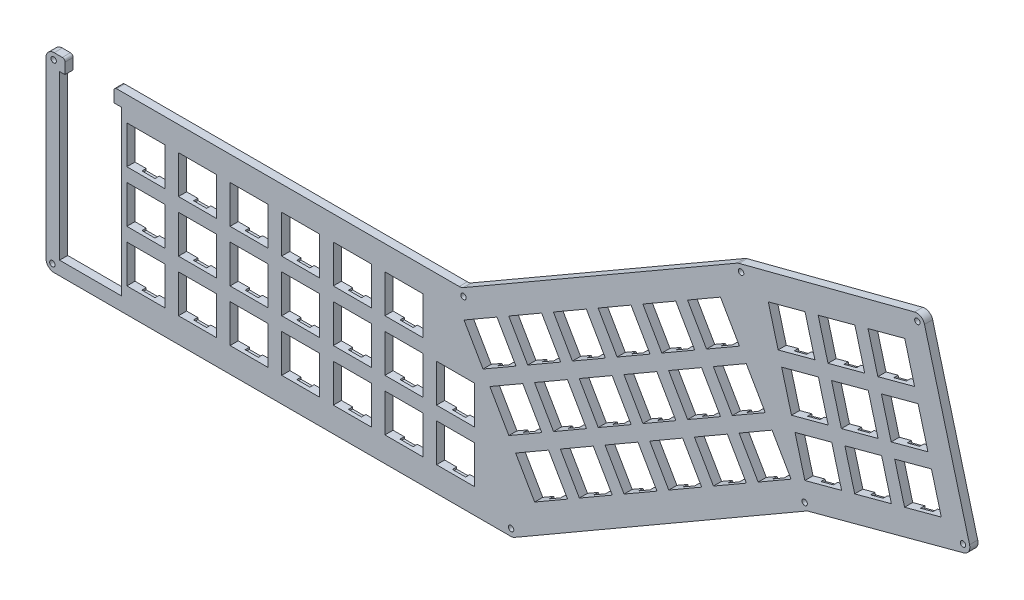
from build123d import *

# Parameters (mm, degrees)
ESQUISSE2_W                           = 14
ESQUISSE2_H                           = 14
BOSS_EXTRU_1_DEPTH                    = 3
ESQUISSE3_W                           = 4.83
ESQUISSE3_H                           = 0.7
ENL_V_MAT_EXTRU_1_DEPTH               = 1.57
R_P_TITION_LIN_AIRE1_COUNT            = 3
R_P_TITION_LIN_AIRE1_PITCH            = 19
R_P_TITION_LIN_AIRE2_COUNT            = 6
R_P_TITION_LIN_AIRE2_PITCH            = 19
R_P_TITION_LIN_AIRE2_COPY_1_SKETCH_W  = 4.83
R_P_TITION_LIN_AIRE2_COPY_1_SKETCH_H  = 0.7
R_P_TITION_LIN_AIRE2_COPY_1_DEPTH     = 1.57
R_P_TITION_LIN_AIRE2_COPY_2_SKETCH_W  = 4.83
R_P_TITION_LIN_AIRE2_COPY_2_SKETCH_H  = 0.7
R_P_TITION_LIN_AIRE2_COPY_2_DEPTH     = 1.57
R_P_TITION_LIN_AIRE2_COPY_3_SKETCH_W  = 4.83
R_P_TITION_LIN_AIRE2_COPY_3_SKETCH_H  = 0.7
R_P_TITION_LIN_AIRE2_COPY_3_DEPTH     = 1.57
R_P_TITION_LIN_AIRE2_COPY_4_SKETCH_W  = 4.83
R_P_TITION_LIN_AIRE2_COPY_4_SKETCH_H  = 0.7
R_P_TITION_LIN_AIRE2_COPY_4_DEPTH     = 1.57
R_P_TITION_LIN_AIRE2_COPY_5_SKETCH_W  = 4.83
R_P_TITION_LIN_AIRE2_COPY_5_SKETCH_H  = 0.7
R_P_TITION_LIN_AIRE2_COPY_5_DEPTH     = 1.57
R_P_TITION_LIN_AIRE2_COPY_6_SKETCH_W  = 4.83
R_P_TITION_LIN_AIRE2_COPY_6_SKETCH_H  = 0.7
R_P_TITION_LIN_AIRE2_COPY_6_DEPTH     = 1.57
R_P_TITION_LIN_AIRE2_COPY_7_SKETCH_W  = 4.83
R_P_TITION_LIN_AIRE2_COPY_7_SKETCH_H  = 0.7
R_P_TITION_LIN_AIRE2_COPY_7_DEPTH     = 1.57
R_P_TITION_LIN_AIRE2_COPY_8_SKETCH_W  = 4.83
R_P_TITION_LIN_AIRE2_COPY_8_SKETCH_H  = 0.7
R_P_TITION_LIN_AIRE2_COPY_8_DEPTH     = 1.57
R_P_TITION_LIN_AIRE2_COPY_9_SKETCH_W  = 4.83
R_P_TITION_LIN_AIRE2_COPY_9_SKETCH_H  = 0.7
R_P_TITION_LIN_AIRE2_COPY_9_DEPTH     = 1.57
R_P_TITION_LIN_AIRE2_COPY_10_SKETCH_W = 4.83
R_P_TITION_LIN_AIRE2_COPY_10_SKETCH_H = 0.7
R_P_TITION_LIN_AIRE2_COPY_10_DEPTH    = 1.57
ESQUISSE4_W                           = 4.83
ESQUISSE4_H                           = 0.7
ENL_V_MAT_EXTRU_2_DEPTH               = 1.57
R_P_TITION_LIN_AIRE3_COUNT            = 2
R_P_TITION_LIN_AIRE3_PITCH            = 19
ENL_V_MAT_EXTRU_3_DEPTH               = 1.57
R_P_TITION_LIN_AIRE4_COUNT            = 3
R_P_TITION_LIN_AIRE4_PITCH            = 19
R_P_TITION_LIN_AIRE5_COUNT            = 6
R_P_TITION_LIN_AIRE5_PITCH            = 19
R_P_TITION_LIN_AIRE5_COPY_1_DEPTH     = 1.57
R_P_TITION_LIN_AIRE5_COPY_2_DEPTH     = 1.57
R_P_TITION_LIN_AIRE5_COPY_3_DEPTH     = 1.57
R_P_TITION_LIN_AIRE5_COPY_4_DEPTH     = 1.57
R_P_TITION_LIN_AIRE5_COPY_5_DEPTH     = 1.57
R_P_TITION_LIN_AIRE5_COPY_6_DEPTH     = 1.57
R_P_TITION_LIN_AIRE5_COPY_7_DEPTH     = 1.57
R_P_TITION_LIN_AIRE5_COPY_8_DEPTH     = 1.57
R_P_TITION_LIN_AIRE5_COPY_9_DEPTH     = 1.57
R_P_TITION_LIN_AIRE5_COPY_10_DEPTH    = 1.57
ENL_V_MAT_EXTRU_4_DEPTH               = 1.57
R_P_TITION_LIN_AIRE6_COUNT            = 3
R_P_TITION_LIN_AIRE6_PITCH            = 19
R_P_TITION_LIN_AIRE7_COUNT            = 3
R_P_TITION_LIN_AIRE7_PITCH            = 19
R_P_TITION_LIN_AIRE7_COPY_1_DEPTH     = 1.57
R_P_TITION_LIN_AIRE7_COPY_2_DEPTH     = 1.57
R_P_TITION_LIN_AIRE7_COPY_3_DEPTH     = 1.57
R_P_TITION_LIN_AIRE7_COPY_4_DEPTH     = 1.57
CONG_2_R                              = 3
ESQUISSE10_R                          = 1
ENL_V_MAT_EXTRU_6_DEPTH               = 10
ESQUISSE11_W                          = 18
ESQUISSE11_H                          = 7.320487292
ENL_V_MAT_EXTRU_7_DEPTH               = 10
CONG_3_R                              = 1


with BuildPart() as part:
    # Esquisse2 → Boss.-Extru.1 (new body)
    with BuildSketch(Plane.XY):
        Polygon((75.33141454, 71.077500491), (-26.464533767, 12.30154537), (-179.373873722, 12.291034855), (-179.373873722, -50.687645053), (-179.373873722, -57.858487698), (-7.520422715, -57.858487698), (100.854480283, 4.809102496), (161.383942986, 21.020985262), (143.246352653, 88.745859712), align=None)
        with Locations((-142.608757489, -41.687645053)):
            Rectangle(ESQUISSE2_W, ESQUISSE2_H, mode=Mode.SUBTRACT)
        with Locations((-123.608757489, -41.687645053)):
            Rectangle(ESQUISSE2_W, ESQUISSE2_H, mode=Mode.SUBTRACT)
        with Locations((-104.608757489, -41.687645053)):
            Rectangle(ESQUISSE2_W, ESQUISSE2_H, mode=Mode.SUBTRACT)
        Polygon((-151.608757489, 7.292943331), (-151.608757489, 5.312354947), (-151.608757489, -50.858487698), (-151.608757489, -52.858487698), (-174.373873722, -52.858487698), (-174.373873722, 7.291378528), align=None, mode=Mode.SUBTRACT)
        with Locations((-142.608757489, -22.687645053)):
            Rectangle(ESQUISSE2_W, ESQUISSE2_H, mode=Mode.SUBTRACT)
        with Locations((-123.608757489, -22.687645053)):
            Rectangle(ESQUISSE2_W, ESQUISSE2_H, mode=Mode.SUBTRACT)
        with Locations((-104.608757489, -22.687645053)):
            Rectangle(ESQUISSE2_W, ESQUISSE2_H, mode=Mode.SUBTRACT)
        with Locations((-85.608757489, -41.687645053)):
            Rectangle(ESQUISSE2_W, ESQUISSE2_H, mode=Mode.SUBTRACT)
        with Locations((-66.608757489, -41.687645053)):
            Rectangle(ESQUISSE2_W, ESQUISSE2_H, mode=Mode.SUBTRACT)
        with Locations((-47.608757489, -41.687645053)):
            Rectangle(ESQUISSE2_W, ESQUISSE2_H, mode=Mode.SUBTRACT)
        with Locations((-28.608757489, -41.687645053)):
            Rectangle(ESQUISSE2_W, ESQUISSE2_H, mode=Mode.SUBTRACT)
        with Locations((-85.608757489, -22.687645053)):
            Rectangle(ESQUISSE2_W, ESQUISSE2_H, mode=Mode.SUBTRACT)
        with Locations((-66.608757489, -22.687645053)):
            Rectangle(ESQUISSE2_W, ESQUISSE2_H, mode=Mode.SUBTRACT)
        with Locations((-47.608757489, -22.687645053)):
            Rectangle(ESQUISSE2_W, ESQUISSE2_H, mode=Mode.SUBTRACT)
        with Locations((-28.608757489, -22.687645053)):
            Rectangle(ESQUISSE2_W, ESQUISSE2_H, mode=Mode.SUBTRACT)
        with Locations((-142.608757489, -3.687645053)):
            Rectangle(ESQUISSE2_W, ESQUISSE2_H, mode=Mode.SUBTRACT)
        with Locations((-123.608757489, -3.687645053)):
            Rectangle(ESQUISSE2_W, ESQUISSE2_H, mode=Mode.SUBTRACT)
        with Locations((-104.608757489, -3.687645053)):
            Rectangle(ESQUISSE2_W, ESQUISSE2_H, mode=Mode.SUBTRACT)
        with Locations((-85.608757489, -3.687645053)):
            Rectangle(ESQUISSE2_W, ESQUISSE2_H, mode=Mode.SUBTRACT)
        with Locations((-66.608757489, -3.687645053)):
            Rectangle(ESQUISSE2_W, ESQUISSE2_H, mode=Mode.SUBTRACT)
        with Locations((-47.608757489, -3.687645053)):
            Rectangle(ESQUISSE2_W, ESQUISSE2_H, mode=Mode.SUBTRACT)
        Polygon((-25.494741241, 2.507177858), (-13.370385588, 9.507177858), (-6.370385588, -2.617177795), (-18.494741241, -9.617177795), align=None, mode=Mode.SUBTRACT)
        Polygon((-6.494741241, -30.401787486), (5.629614412, -23.401787486), (12.629614412, -35.526143139), (0.505258759, -42.526143139), align=None, mode=Mode.SUBTRACT)
        Polygon((9.959741431, -20.901787486), (22.084097084, -13.901787486), (29.084097084, -26.026143139), (16.959741431, -33.026143139), align=None, mode=Mode.SUBTRACT)
        Polygon((-15.994741241, -13.947304814), (-3.870385588, -6.947304814), (3.129614412, -19.071660467), (-8.994741241, -26.071660467), align=None, mode=Mode.SUBTRACT)
        Polygon((0.459741431, -4.447304814), (12.584097084, 2.552695186), (19.584097084, -9.571660467), (7.459741431, -16.571660467), align=None, mode=Mode.SUBTRACT)
        Polygon((26.414224103, -11.401787486), (38.538579756, -4.401787486), (45.538579756, -16.526143139), (33.414224103, -23.526143139), align=None, mode=Mode.SUBTRACT)
        Polygon((42.868706775, -1.901787486), (54.993062428, 5.098212514), (61.993062428, -7.026143139), (49.868706775, -14.026143139), align=None, mode=Mode.SUBTRACT)
        Polygon((16.914224103, 5.052695186), (29.038579756, 12.052695186), (36.038579756, -0.071660467), (23.914224103, -7.071660467), align=None, mode=Mode.SUBTRACT)
        Polygon((-9.040258569, 12.007177858), (3.084097084, 19.007177858), (10.084097084, 6.882822205), (-2.040258569, -0.117177795), align=None, mode=Mode.SUBTRACT)
        Polygon((59.323189447, 7.598212514), (71.4475451, 14.598212514), (78.4475451, 2.473856861), (66.323189447, -4.526143139), align=None, mode=Mode.SUBTRACT)
        Polygon((33.368706775, 14.552695186), (45.493062428, 21.552695186), (52.493062428, 9.428339533), (40.368706775, 2.428339533), align=None, mode=Mode.SUBTRACT)
        Polygon((75.777672119, 17.098212514), (87.902027772, 24.098212514), (94.902027772, 11.973856861), (82.777672119, 4.973856861), align=None, mode=Mode.SUBTRACT)
        Polygon((7.414224103, 21.507177858), (19.538579756, 28.507177858), (26.538579756, 16.382822205), (14.414224103, 9.382822205), align=None, mode=Mode.SUBTRACT)
        Polygon((23.868706775, 31.007177858), (35.993062428, 38.007177858), (42.993062428, 25.882822205), (30.868706775, 18.882822205), align=None, mode=Mode.SUBTRACT)
        Polygon((49.823189447, 24.052695186), (61.9475451, 31.052695186), (68.9475451, 18.928339533), (56.823189447, 11.928339533), align=None, mode=Mode.SUBTRACT)
        Polygon((66.277672119, 33.552695186), (78.402027772, 40.552695186), (85.402027772, 28.428339533), (73.277672119, 21.428339533), align=None, mode=Mode.SUBTRACT)
        Polygon((40.323189447, 40.507177858), (52.4475451, 47.507177858), (59.4475451, 35.382822205), (47.323189447, 28.382822205), align=None, mode=Mode.SUBTRACT)
        Polygon((56.777672119, 50.007177858), (68.902027772, 57.007177858), (75.902027772, 44.882822205), (63.777672119, 37.882822205), align=None, mode=Mode.SUBTRACT)
        Polygon((99.972171674, 14.073979229), (96.348705043, 27.596940797), (109.871666611, 31.220407428), (113.495133242, 17.69744586), align=None, mode=Mode.SUBTRACT)
        Polygon((118.324762374, 18.991541086), (114.701295742, 32.514502654), (128.22425731, 36.137969285), (131.847723942, 22.615007717), align=None, mode=Mode.SUBTRACT)
        Polygon((136.677353073, 23.909102943), (133.053886442, 37.432064511), (146.57684801, 41.055531142), (150.200314641, 27.532569574), align=None, mode=Mode.SUBTRACT)
        Polygon((95.054609817, 32.426569928), (91.431143186, 45.949531496), (104.954104754, 49.572998128), (108.577571385, 36.05003656), align=None, mode=Mode.SUBTRACT)
        Polygon((113.407200517, 37.344131785), (109.783733885, 50.867093353), (123.306695453, 54.490559985), (126.930162085, 40.967598417), align=None, mode=Mode.SUBTRACT)
        Polygon((131.759791216, 42.261693642), (128.136324585, 55.78465521), (141.659286153, 59.408121842), (145.282752784, 45.885160273), align=None, mode=Mode.SUBTRACT)
        Polygon((90.13704796, 50.779160628), (86.513581329, 64.302122196), (100.036542897, 67.925588827), (103.660009528, 54.402627259), align=None, mode=Mode.SUBTRACT)
        Polygon((108.48963866, 55.696722485), (104.866172028, 69.219684053), (118.389133596, 72.843150684), (122.012600228, 59.320189116), align=None, mode=Mode.SUBTRACT)
        Polygon((126.842229359, 60.614284342), (123.218762728, 74.13724591), (136.741724296, 77.760712541), (140.365190927, 64.237750973), align=None, mode=Mode.SUBTRACT)
    extrude(amount=BOSS_EXTRU_1_DEPTH)

    # Esquisse3 → Enlèv. mat.-Extru.1 (cut)
    with BuildSketch(Plane(origin=(0, 0, 0), x_dir=(-1, 0, 0), z_dir=(0, 0, -1))):
        with Locations((143.081022506, 3.662354947)):
            Rectangle(ESQUISSE3_W, ESQUISSE3_H)
        with Locations((143.081022506, -11.037645053)):
            Rectangle(ESQUISSE3_W, ESQUISSE3_H)
    enl_v_mat_extru_1 = extrude(amount=-ENL_V_MAT_EXTRU_1_DEPTH, mode=Mode.SUBTRACT)

    # Répétition linéaire1: Enlèv. mat.-Extru.1 ×3
    with Locations(*[(0, -i * R_P_TITION_LIN_AIRE1_PITCH, 0) for i in range(1, R_P_TITION_LIN_AIRE1_COUNT)]):
        add(enl_v_mat_extru_1, mode=Mode.SUBTRACT)

    # Répétition linéaire2: Enlèv. mat.-Extru.1 ×6
    with Locations(*[(i * R_P_TITION_LIN_AIRE2_PITCH, 0, 0) for i in range(1, R_P_TITION_LIN_AIRE2_COUNT)]):
        add(enl_v_mat_extru_1, mode=Mode.SUBTRACT)

    # Répétition linéaire2 copy 1 sketch → Répétition linéaire2 copy 1 (cut)
    with BuildSketch(Plane(origin=(19, -19, 0), x_dir=(-1, 0, 0), z_dir=(0, 0, -1))):
        with Locations((143.081022506, 3.662354947)):
            Rectangle(R_P_TITION_LIN_AIRE2_COPY_1_SKETCH_W, R_P_TITION_LIN_AIRE2_COPY_1_SKETCH_H)
        with Locations((143.081022506, -11.037645053)):
            Rectangle(R_P_TITION_LIN_AIRE2_COPY_1_SKETCH_W, R_P_TITION_LIN_AIRE2_COPY_1_SKETCH_H)
    extrude(amount=-R_P_TITION_LIN_AIRE2_COPY_1_DEPTH, mode=Mode.SUBTRACT)

    # Répétition linéaire2 copy 2 sketch → Répétition linéaire2 copy 2 (cut)
    with BuildSketch(Plane(origin=(38, -19, 0), x_dir=(-1, 0, 0), z_dir=(0, 0, -1))):
        with Locations((143.081022506, 3.662354947)):
            Rectangle(R_P_TITION_LIN_AIRE2_COPY_2_SKETCH_W, R_P_TITION_LIN_AIRE2_COPY_2_SKETCH_H)
        with Locations((143.081022506, -11.037645053)):
            Rectangle(R_P_TITION_LIN_AIRE2_COPY_2_SKETCH_W, R_P_TITION_LIN_AIRE2_COPY_2_SKETCH_H)
    extrude(amount=-R_P_TITION_LIN_AIRE2_COPY_2_DEPTH, mode=Mode.SUBTRACT)

    # Répétition linéaire2 copy 3 sketch → Répétition linéaire2 copy 3 (cut)
    with BuildSketch(Plane(origin=(57, -19, 0), x_dir=(-1, 0, 0), z_dir=(0, 0, -1))):
        with Locations((143.081022506, 3.662354947)):
            Rectangle(R_P_TITION_LIN_AIRE2_COPY_3_SKETCH_W, R_P_TITION_LIN_AIRE2_COPY_3_SKETCH_H)
        with Locations((143.081022506, -11.037645053)):
            Rectangle(R_P_TITION_LIN_AIRE2_COPY_3_SKETCH_W, R_P_TITION_LIN_AIRE2_COPY_3_SKETCH_H)
    extrude(amount=-R_P_TITION_LIN_AIRE2_COPY_3_DEPTH, mode=Mode.SUBTRACT)

    # Répétition linéaire2 copy 4 sketch → Répétition linéaire2 copy 4 (cut)
    with BuildSketch(Plane(origin=(76, -19, 0), x_dir=(-1, 0, 0), z_dir=(0, 0, -1))):
        with Locations((143.081022506, 3.662354947)):
            Rectangle(R_P_TITION_LIN_AIRE2_COPY_4_SKETCH_W, R_P_TITION_LIN_AIRE2_COPY_4_SKETCH_H)
        with Locations((143.081022506, -11.037645053)):
            Rectangle(R_P_TITION_LIN_AIRE2_COPY_4_SKETCH_W, R_P_TITION_LIN_AIRE2_COPY_4_SKETCH_H)
    extrude(amount=-R_P_TITION_LIN_AIRE2_COPY_4_DEPTH, mode=Mode.SUBTRACT)

    # Répétition linéaire2 copy 5 sketch → Répétition linéaire2 copy 5 (cut)
    with BuildSketch(Plane(origin=(95, -19, 0), x_dir=(-1, 0, 0), z_dir=(0, 0, -1))):
        with Locations((143.081022506, 3.662354947)):
            Rectangle(R_P_TITION_LIN_AIRE2_COPY_5_SKETCH_W, R_P_TITION_LIN_AIRE2_COPY_5_SKETCH_H)
        with Locations((143.081022506, -11.037645053)):
            Rectangle(R_P_TITION_LIN_AIRE2_COPY_5_SKETCH_W, R_P_TITION_LIN_AIRE2_COPY_5_SKETCH_H)
    extrude(amount=-R_P_TITION_LIN_AIRE2_COPY_5_DEPTH, mode=Mode.SUBTRACT)

    # Répétition linéaire2 copy 6 sketch → Répétition linéaire2 copy 6 (cut)
    with BuildSketch(Plane(origin=(19, -38, 0), x_dir=(-1, 0, 0), z_dir=(0, 0, -1))):
        with Locations((143.081022506, 3.662354947)):
            Rectangle(R_P_TITION_LIN_AIRE2_COPY_6_SKETCH_W, R_P_TITION_LIN_AIRE2_COPY_6_SKETCH_H)
        with Locations((143.081022506, -11.037645053)):
            Rectangle(R_P_TITION_LIN_AIRE2_COPY_6_SKETCH_W, R_P_TITION_LIN_AIRE2_COPY_6_SKETCH_H)
    extrude(amount=-R_P_TITION_LIN_AIRE2_COPY_6_DEPTH, mode=Mode.SUBTRACT)

    # Répétition linéaire2 copy 7 sketch → Répétition linéaire2 copy 7 (cut)
    with BuildSketch(Plane(origin=(38, -38, 0), x_dir=(-1, 0, 0), z_dir=(0, 0, -1))):
        with Locations((143.081022506, 3.662354947)):
            Rectangle(R_P_TITION_LIN_AIRE2_COPY_7_SKETCH_W, R_P_TITION_LIN_AIRE2_COPY_7_SKETCH_H)
        with Locations((143.081022506, -11.037645053)):
            Rectangle(R_P_TITION_LIN_AIRE2_COPY_7_SKETCH_W, R_P_TITION_LIN_AIRE2_COPY_7_SKETCH_H)
    extrude(amount=-R_P_TITION_LIN_AIRE2_COPY_7_DEPTH, mode=Mode.SUBTRACT)

    # Répétition linéaire2 copy 8 sketch → Répétition linéaire2 copy 8 (cut)
    with BuildSketch(Plane(origin=(57, -38, 0), x_dir=(-1, 0, 0), z_dir=(0, 0, -1))):
        with Locations((143.081022506, 3.662354947)):
            Rectangle(R_P_TITION_LIN_AIRE2_COPY_8_SKETCH_W, R_P_TITION_LIN_AIRE2_COPY_8_SKETCH_H)
        with Locations((143.081022506, -11.037645053)):
            Rectangle(R_P_TITION_LIN_AIRE2_COPY_8_SKETCH_W, R_P_TITION_LIN_AIRE2_COPY_8_SKETCH_H)
    extrude(amount=-R_P_TITION_LIN_AIRE2_COPY_8_DEPTH, mode=Mode.SUBTRACT)

    # Répétition linéaire2 copy 9 sketch → Répétition linéaire2 copy 9 (cut)
    with BuildSketch(Plane(origin=(76, -38, 0), x_dir=(-1, 0, 0), z_dir=(0, 0, -1))):
        with Locations((143.081022506, 3.662354947)):
            Rectangle(R_P_TITION_LIN_AIRE2_COPY_9_SKETCH_W, R_P_TITION_LIN_AIRE2_COPY_9_SKETCH_H)
        with Locations((143.081022506, -11.037645053)):
            Rectangle(R_P_TITION_LIN_AIRE2_COPY_9_SKETCH_W, R_P_TITION_LIN_AIRE2_COPY_9_SKETCH_H)
    extrude(amount=-R_P_TITION_LIN_AIRE2_COPY_9_DEPTH, mode=Mode.SUBTRACT)

    # Répétition linéaire2 copy 10 sketch → Répétition linéaire2 copy 10 (cut)
    with BuildSketch(Plane(origin=(95, -38, 0), x_dir=(-1, 0, 0), z_dir=(0, 0, -1))):
        with Locations((143.081022506, 3.662354947)):
            Rectangle(R_P_TITION_LIN_AIRE2_COPY_10_SKETCH_W, R_P_TITION_LIN_AIRE2_COPY_10_SKETCH_H)
        with Locations((143.081022506, -11.037645053)):
            Rectangle(R_P_TITION_LIN_AIRE2_COPY_10_SKETCH_W, R_P_TITION_LIN_AIRE2_COPY_10_SKETCH_H)
    extrude(amount=-R_P_TITION_LIN_AIRE2_COPY_10_DEPTH, mode=Mode.SUBTRACT)

    # Esquisse4 → Enlèv. mat.-Extru.2 (cut)
    with BuildSketch(Plane(origin=(0, 0, 0), x_dir=(-1, 0, 0), z_dir=(0, 0, -1))):
        with Locations((28.76106948, -15.337645053)):
            Rectangle(ESQUISSE4_W, ESQUISSE4_H)
        with Locations((28.76106948, -30.037645053)):
            Rectangle(ESQUISSE4_W, ESQUISSE4_H)
    enl_v_mat_extru_2 = extrude(amount=-ENL_V_MAT_EXTRU_2_DEPTH, mode=Mode.SUBTRACT)

    # Répétition linéaire3: Enlèv. mat.-Extru.2 ×2
    with Locations(*[(0, -i * R_P_TITION_LIN_AIRE3_PITCH, 0) for i in range(1, R_P_TITION_LIN_AIRE3_COUNT)]):
        add(enl_v_mat_extru_2, mode=Mode.SUBTRACT)

    # Esquisse6 → Enlèv. mat.-Extru.3 (cut)
    with BuildSketch(Plane(origin=(0, 0, 0), x_dir=(-1, 0, 0), z_dir=(0, 0, -1))):
        Polygon((17.330819297, 7.22062039), (21.513721997, 4.80562039), (21.863602937, 5.411631954), (17.680700237, 7.826631954), align=None)
        Polygon((10.330819297, -4.903735263), (14.513721997, -7.318735263), (14.163841058, -7.924746828), (9.980938357, -5.509746828), align=None)
    enl_v_mat_extru_3 = extrude(amount=-ENL_V_MAT_EXTRU_3_DEPTH, mode=Mode.SUBTRACT)

    # Répétition linéaire4: Enlèv. mat.-Extru.3 ×3
    with Locations(*[Vector(0.4999999999994475, -0.8660254037847577, 0) * (i * R_P_TITION_LIN_AIRE4_PITCH) for i in range(1, R_P_TITION_LIN_AIRE4_COUNT)]):
        add(enl_v_mat_extru_3, mode=Mode.SUBTRACT)

    # Répétition linéaire5: Enlèv. mat.-Extru.3 ×6
    with Locations(*[Vector(0.8660254037829719, 0.5000000000025406, 0) * (i * R_P_TITION_LIN_AIRE5_PITCH) for i in range(1, R_P_TITION_LIN_AIRE5_COUNT)]):
        add(enl_v_mat_extru_3, mode=Mode.SUBTRACT)

    # Répétition linéaire5 copy 1 sketch → Répétition linéaire5 copy 1 (cut)
    with BuildSketch(Plane(origin=(25.954482672, -6.954482672, 0), x_dir=(-1, 0, 0), z_dir=(0, 0, -1))):
        Polygon((17.330819297, 7.22062039), (21.513721997, 4.80562039), (21.863602937, 5.411631954), (17.680700237, 7.826631954), align=None)
        Polygon((10.330819297, -4.903735263), (14.513721997, -7.318735263), (14.163841058, -7.924746828), (9.980938357, -5.509746828), align=None)
    extrude(amount=-R_P_TITION_LIN_AIRE5_COPY_1_DEPTH, mode=Mode.SUBTRACT)

    # Répétition linéaire5 copy 2 sketch → Répétition linéaire5 copy 2 (cut)
    with BuildSketch(Plane(origin=(42.408965344, 2.545517328, 0), x_dir=(-1, 0, 0), z_dir=(0, 0, -1))):
        Polygon((17.330819297, 7.22062039), (21.513721997, 4.80562039), (21.863602937, 5.411631954), (17.680700237, 7.826631954), align=None)
        Polygon((10.330819297, -4.903735263), (14.513721997, -7.318735263), (14.163841058, -7.924746828), (9.980938357, -5.509746828), align=None)
    extrude(amount=-R_P_TITION_LIN_AIRE5_COPY_2_DEPTH, mode=Mode.SUBTRACT)

    # Répétition linéaire5 copy 3 sketch → Répétition linéaire5 copy 3 (cut)
    with BuildSketch(Plane(origin=(58.863448016, 12.045517328, 0), x_dir=(-1, 0, 0), z_dir=(0, 0, -1))):
        Polygon((17.330819297, 7.22062039), (21.513721997, 4.80562039), (21.863602937, 5.411631954), (17.680700237, 7.826631954), align=None)
        Polygon((10.330819297, -4.903735263), (14.513721997, -7.318735263), (14.163841058, -7.924746828), (9.980938357, -5.509746828), align=None)
    extrude(amount=-R_P_TITION_LIN_AIRE5_COPY_3_DEPTH, mode=Mode.SUBTRACT)

    # Répétition linéaire5 copy 4 sketch → Répétition linéaire5 copy 4 (cut)
    with BuildSketch(Plane(origin=(75.317930687, 21.545517328, 0), x_dir=(-1, 0, 0), z_dir=(0, 0, -1))):
        Polygon((17.330819297, 7.22062039), (21.513721997, 4.80562039), (21.863602937, 5.411631954), (17.680700237, 7.826631954), align=None)
        Polygon((10.330819297, -4.903735263), (14.513721997, -7.318735263), (14.163841058, -7.924746828), (9.980938357, -5.509746828), align=None)
    extrude(amount=-R_P_TITION_LIN_AIRE5_COPY_4_DEPTH, mode=Mode.SUBTRACT)

    # Répétition linéaire5 copy 5 sketch → Répétition linéaire5 copy 5 (cut)
    with BuildSketch(Plane(origin=(91.772413359, 31.045517328, 0), x_dir=(-1, 0, 0), z_dir=(0, 0, -1))):
        Polygon((17.330819297, 7.22062039), (21.513721997, 4.80562039), (21.863602937, 5.411631954), (17.680700237, 7.826631954), align=None)
        Polygon((10.330819297, -4.903735263), (14.513721997, -7.318735263), (14.163841058, -7.924746828), (9.980938357, -5.509746828), align=None)
    extrude(amount=-R_P_TITION_LIN_AIRE5_COPY_5_DEPTH, mode=Mode.SUBTRACT)

    # Répétition linéaire5 copy 6 sketch → Répétition linéaire5 copy 6 (cut)
    with BuildSketch(Plane(origin=(35.454482672, -23.408965344, 0), x_dir=(-1, 0, 0), z_dir=(0, 0, -1))):
        Polygon((17.330819297, 7.22062039), (21.513721997, 4.80562039), (21.863602937, 5.411631954), (17.680700237, 7.826631954), align=None)
        Polygon((10.330819297, -4.903735263), (14.513721997, -7.318735263), (14.163841058, -7.924746828), (9.980938357, -5.509746828), align=None)
    extrude(amount=-R_P_TITION_LIN_AIRE5_COPY_6_DEPTH, mode=Mode.SUBTRACT)

    # Répétition linéaire5 copy 7 sketch → Répétition linéaire5 copy 7 (cut)
    with BuildSketch(Plane(origin=(51.908965344, -13.908965344, 0), x_dir=(-1, 0, 0), z_dir=(0, 0, -1))):
        Polygon((17.330819297, 7.22062039), (21.513721997, 4.80562039), (21.863602937, 5.411631954), (17.680700237, 7.826631954), align=None)
        Polygon((10.330819297, -4.903735263), (14.513721997, -7.318735263), (14.163841058, -7.924746828), (9.980938357, -5.509746828), align=None)
    extrude(amount=-R_P_TITION_LIN_AIRE5_COPY_7_DEPTH, mode=Mode.SUBTRACT)

    # Répétition linéaire5 copy 8 sketch → Répétition linéaire5 copy 8 (cut)
    with BuildSketch(Plane(origin=(68.363448016, -4.408965344, 0), x_dir=(-1, 0, 0), z_dir=(0, 0, -1))):
        Polygon((17.330819297, 7.22062039), (21.513721997, 4.80562039), (21.863602937, 5.411631954), (17.680700237, 7.826631954), align=None)
        Polygon((10.330819297, -4.903735263), (14.513721997, -7.318735263), (14.163841058, -7.924746828), (9.980938357, -5.509746828), align=None)
    extrude(amount=-R_P_TITION_LIN_AIRE5_COPY_8_DEPTH, mode=Mode.SUBTRACT)

    # Répétition linéaire5 copy 9 sketch → Répétition linéaire5 copy 9 (cut)
    with BuildSketch(Plane(origin=(84.817930687, 5.091034656, 0), x_dir=(-1, 0, 0), z_dir=(0, 0, -1))):
        Polygon((17.330819297, 7.22062039), (21.513721997, 4.80562039), (21.863602937, 5.411631954), (17.680700237, 7.826631954), align=None)
        Polygon((10.330819297, -4.903735263), (14.513721997, -7.318735263), (14.163841058, -7.924746828), (9.980938357, -5.509746828), align=None)
    extrude(amount=-R_P_TITION_LIN_AIRE5_COPY_9_DEPTH, mode=Mode.SUBTRACT)

    # Répétition linéaire5 copy 10 sketch → Répétition linéaire5 copy 10 (cut)
    with BuildSketch(Plane(origin=(101.272413359, 14.591034656, 0), x_dir=(-1, 0, 0), z_dir=(0, 0, -1))):
        Polygon((17.330819297, 7.22062039), (21.513721997, 4.80562039), (21.863602937, 5.411631954), (17.680700237, 7.826631954), align=None)
        Polygon((10.330819297, -4.903735263), (14.513721997, -7.318735263), (14.163841058, -7.924746828), (9.980938357, -5.509746828), align=None)
    extrude(amount=-R_P_TITION_LIN_AIRE5_COPY_10_DEPTH, mode=Mode.SUBTRACT)

    # Esquisse7 → Enlèv. mat.-Extru.4 (cut)
    with BuildSketch(Plane(origin=(0, 0, 0), x_dir=(-1, 0, 0), z_dir=(0, 0, -1))):
        Polygon((-95.590942143, 66.734393695), (-90.959182082, 65.493317328), (-90.774300447, 66.183304984), (-95.406060508, 67.424381352), align=None)
        Polygon((-94.582648714, 51.97035576), (-94.767530349, 51.280368103), (-99.39929041, 52.521444471), (-99.214408775, 53.211432127), align=None)
    enl_v_mat_extru_4 = extrude(amount=-ENL_V_MAT_EXTRU_4_DEPTH, mode=Mode.SUBTRACT)

    # Répétition linéaire6: Enlèv. mat.-Extru.4 ×3
    with Locations(*[Vector(0.2588190450992223, -0.9659258262899522, 0) * (i * R_P_TITION_LIN_AIRE6_PITCH) for i in range(1, R_P_TITION_LIN_AIRE6_COUNT)]):
        add(enl_v_mat_extru_4, mode=Mode.SUBTRACT)

    # Répétition linéaire7: Enlèv. mat.-Extru.4 ×3
    with Locations(*[Vector(0.9659258262899522, 0.25881904509922216, 0) * (i * R_P_TITION_LIN_AIRE7_PITCH) for i in range(1, R_P_TITION_LIN_AIRE7_COUNT)]):
        add(enl_v_mat_extru_4, mode=Mode.SUBTRACT)

    # Répétition linéaire7 copy 1 sketch → Répétition linéaire7 copy 1 (cut)
    with BuildSketch(Plane(origin=(23.270152556, -13.435028843, 0), x_dir=(-1, 0, 0), z_dir=(0, 0, -1))):
        Polygon((-95.590942143, 66.734393695), (-90.959182082, 65.493317328), (-90.774300447, 66.183304984), (-95.406060508, 67.424381352), align=None)
        Polygon((-94.582648714, 51.97035576), (-94.767530349, 51.280368103), (-99.39929041, 52.521444471), (-99.214408775, 53.211432127), align=None)
    extrude(amount=-R_P_TITION_LIN_AIRE7_COPY_1_DEPTH, mode=Mode.SUBTRACT)

    # Répétition linéaire7 copy 2 sketch → Répétition linéaire7 copy 2 (cut)
    with BuildSketch(Plane(origin=(41.622743256, -8.517466986, 0), x_dir=(-1, 0, 0), z_dir=(0, 0, -1))):
        Polygon((-95.590942143, 66.734393695), (-90.959182082, 65.493317328), (-90.774300447, 66.183304984), (-95.406060508, 67.424381352), align=None)
        Polygon((-94.582648714, 51.97035576), (-94.767530349, 51.280368103), (-99.39929041, 52.521444471), (-99.214408775, 53.211432127), align=None)
    extrude(amount=-R_P_TITION_LIN_AIRE7_COPY_2_DEPTH, mode=Mode.SUBTRACT)

    # Répétition linéaire7 copy 3 sketch → Répétition linéaire7 copy 3 (cut)
    with BuildSketch(Plane(origin=(28.187714413, -31.787619542, 0), x_dir=(-1, 0, 0), z_dir=(0, 0, -1))):
        Polygon((-95.590942143, 66.734393695), (-90.959182082, 65.493317328), (-90.774300447, 66.183304984), (-95.406060508, 67.424381352), align=None)
        Polygon((-94.582648714, 51.97035576), (-94.767530349, 51.280368103), (-99.39929041, 52.521444471), (-99.214408775, 53.211432127), align=None)
    extrude(amount=-R_P_TITION_LIN_AIRE7_COPY_3_DEPTH, mode=Mode.SUBTRACT)

    # Répétition linéaire7 copy 4 sketch → Répétition linéaire7 copy 4 (cut)
    with BuildSketch(Plane(origin=(46.540305113, -26.870057685, 0), x_dir=(-1, 0, 0), z_dir=(0, 0, -1))):
        Polygon((-95.590942143, 66.734393695), (-90.959182082, 65.493317328), (-90.774300447, 66.183304984), (-95.406060508, 67.424381352), align=None)
        Polygon((-94.582648714, 51.97035576), (-94.767530349, 51.280368103), (-99.39929041, 52.521444471), (-99.214408775, 53.211432127), align=None)
    extrude(amount=-R_P_TITION_LIN_AIRE7_COPY_4_DEPTH, mode=Mode.SUBTRACT)

    # Congé2
    cong_2_edges = [part.edges().sort_by_distance(p)[0] for p in [
        (75.33141454, 71.077500491, 1.5),
        (-26.464533767, 12.30154537, 1.5),
        (-179.373873722, 12.291034855, 1.5),
        (-179.373873722, -57.858487698, 1.5),
        (-7.520422715, -57.858487698, 1.5),
        (100.854480283, 4.809102496, 1.5),
        (161.383942986, 21.020985262, 1.5),
        (143.246352653, 88.745859712, 1.5),
    ]]
    fillet(cong_2_edges, radius=CONG_2_R)

    # Esquisse10 → Enlèv. mat.-Extru.6 (cut)
    with BuildSketch(Plane.XY.offset(3)):
        with Locations((158.201617013, 22.958080812)):
            Circle(ESQUISSE10_R)
        with Locations((141.388472611, 85.534334234)):
            Circle(ESQUISSE10_R)
        with Locations((76.500226548, 68.776582274)):
            Circle(ESQUISSE10_R)
        with Locations((99.890442316, 7.071415488)):
            Circle(ESQUISSE10_R)
        with Locations((-8.172352823, -55.275906246)):
            Circle(ESQUISSE10_R)
        with Locations((-25.691359515, 9.920090126)):
            Circle(ESQUISSE10_R)
        with Locations((-176.562127678, 9.920090126)):
            Circle(ESQUISSE10_R)
        with Locations((-177.029598341, -55.275906246)):
            Circle(ESQUISSE10_R)
    extrude(amount=-ENL_V_MAT_EXTRU_6_DEPTH, mode=Mode.SUBTRACT)

    # Esquisse11 → Enlèv. mat.-Extru.7 (cut)
    with BuildSketch(Plane(origin=(-0.000845695, 12.303364402, 0), x_dir=(0.9999999976376189, 6.873690724146591e-05, 0), z_dir=(-6.873690724146591e-05, 0.9999999976376189, 0))):
        with Locations((-163.373234654, -1.513462619)):
            Rectangle(ESQUISSE11_W, ESQUISSE11_H)
    extrude(amount=-ENL_V_MAT_EXTRU_7_DEPTH, mode=Mode.SUBTRACT)

    # Congé3
    cong_3_edges = [part.edges().sort_by_distance(p)[0] for p in [
        (-154.374079985, 12.292753263, 1.5),
        (-172.374079942, 12.291515999, 1.5),
    ]]
    fillet(cong_3_edges, radius=CONG_3_R)


solid = part.part
